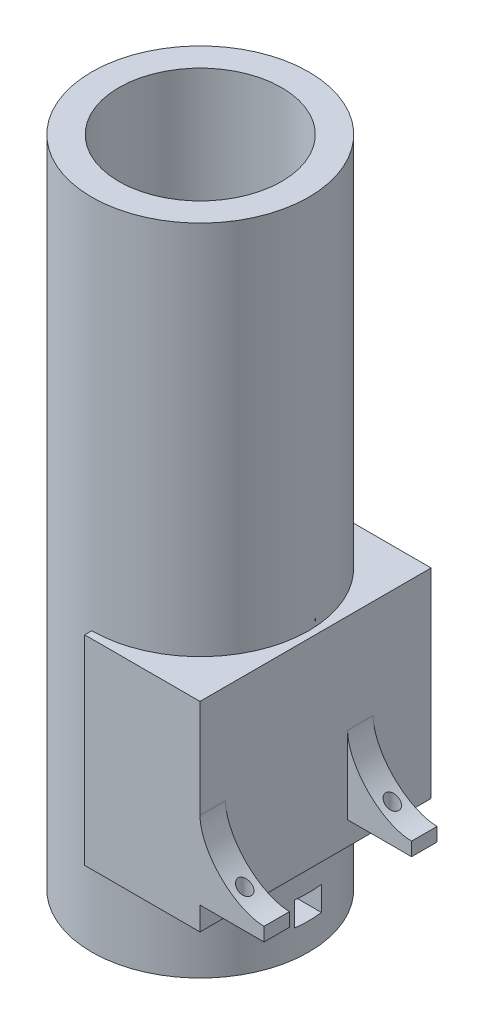
from build123d import *

# Parameters (mm, degrees)
SKETCH1_R                = 20
BOSS_EXTRUDE1_DEPTH      = 120.5
BOSS_EXTRUDE2_START      = 14.5
BOSS_EXTRUDE2_DEPTH      = 36.8
SKETCH7_W                = 4.7
SKETCH7_H                = 2.5
BOSS_EXTRUDE3_DEPTH      = 11.8
SKETCH2_R                = 15
CUT_EXTRUDE2_DEPTH       = 115.5
CUT_EXTRUDE3_REACH       = 135.373
CUT_EXTRUDE3_END_RADIUS  = 15
SKETCH12_W               = 30
SKETCH12_H               = 5.5
CUT_EXTRUDE5_DEPTH       = 5
FILLET3_SIZE             = 2.5
M2_CLEARANCE_HOLE3_D     = 2.4
M2_CLEARANCE_HOLE3_DEPTH = 2.5
M2_CLEARANCE_HOLE3_TIP   = 0.721032743
FILLET4_SIZE             = 11.8
CUT_EXTRUDE6_REACH       = 130.74
CUT_EXTRUDE6_END_RADIUS  = 15


with BuildPart() as part:
    # Sketch1 → Boss-Extrude1 (new body)
    with BuildSketch(Plane(origin=(0, 0, 0), x_dir=(1, 0, 0), z_dir=(0, 1, 0))):
        with Locations(Location((0, 0, 0), (0, 0, 270))):
            Circle(SKETCH1_R)
    extrude(amount=BOSS_EXTRUDE1_DEPTH)

    # Sketch6 → Boss-Extrude2 (add)
    with BuildSketch(Plane(origin=(0, 0, 0), x_dir=(1, 0, 0), z_dir=(0, 1, 0)).offset(BOSS_EXTRUDE2_START)):
        Polygon((21.25, 21.3), (21.25, 0), (21.25, -21.3), (0, -21.3), (0, 0), (0, 21.3), align=None)
    extrude(amount=BOSS_EXTRUDE2_DEPTH)

    # Sketch7 → Boss-Extrude3 (add)
    with BuildSketch(Plane(origin=(21.25, 0, 0), x_dir=(0, 0, -1), z_dir=(1, 0, 0))):
        with Locations((8.25, 20.05)):
            Rectangle(SKETCH7_W, SKETCH7_H)
        with Locations((-18.95, 20.05)):
            Rectangle(SKETCH7_W, SKETCH7_H)
    extrude(amount=BOSS_EXTRUDE3_DEPTH)

    # Sketch2 → Cut-Extrude2 (cut)
    with BuildSketch(Plane(origin=(0, 120.5, 0), x_dir=(1, 0, 0), z_dir=(0, 1, 0))):
        with Locations(Location((0, 0, 0), (0, 0, 270))):
            Circle(SKETCH2_R)
    extrude(amount=-CUT_EXTRUDE2_DEPTH, mode=Mode.SUBTRACT)

    # Cut-Extrude3: up to this cylinder (the profile starts outside it)
    cut_extrude3_end = Plane(origin=(0, 7.75, 0), z_dir=(0, 1, 0)) * Cylinder(CUT_EXTRUDE3_END_RADIUS, 301.746, mode=Mode.PRIVATE)
    # Sketch12 → Cut-Extrude3 (cut, up to the surface)
    with BuildSketch(Plane.ZY.offset(20), mode=Mode.PRIVATE) as cut_extrude3_sk1:
        with Locations((0, 7.75)):
            Rectangle(SKETCH12_W, SKETCH12_H)
    cut_extrude3_tool1 = extrude(cut_extrude3_sk1.sketch, amount=-CUT_EXTRUDE3_REACH, mode=Mode.PRIVATE) - cut_extrude3_end
    add(cut_extrude3_tool1.solids().sort_by_distance((-20, 7.75, 0))[0], mode=Mode.SUBTRACT)

    # Sketch13 → Cut-Extrude5 (cut)
    with BuildSketch(Plane.XZ):
        with BuildLine():
            Line((-13.228756555, 15), (-13.228756555, -15))
            ThreePointArc((-13.228756555, -15), (-20, 0), (-13.228756555, 15))
        make_face()
    extrude(amount=-CUT_EXTRUDE5_DEPTH, mode=Mode.SUBTRACT)

    # Fillet3
    # a fillet whose section is not a circle: 2.5 mm, written as the material it takes off along each edge
    with BuildSketch(Plane(origin=(-13.228756555, 5, 15), x_dir=(0, -1, 0), z_dir=(0, 0, -1))) as fillet3_piece_1:
        with BuildLine():
            Bezier((FILLET3_SIZE, 0), (0, 0), (0, -FILLET3_SIZE), weights=[1, 1.222222222, 1])
            Line((0, -FILLET3_SIZE), (0, 0))
            Line((0, 0), (FILLET3_SIZE, 0))
        make_face()
    extrude(amount=30, mode=Mode.SUBTRACT)

    # M2 Clearance Hole3
    with Locations(Plane(origin=(0, 18.8, 0), x_dir=(-1, 0, 0), z_dir=(0, -1, 0))):
        with Locations((-27.15, 8.25), (-27.15, -18.95)):
            Hole(M2_CLEARANCE_HOLE3_D / 2, depth=M2_CLEARANCE_HOLE3_DEPTH)
            with Locations((0, 0, -(M2_CLEARANCE_HOLE3_DEPTH + M2_CLEARANCE_HOLE3_TIP / 2))):  # 118° drill point
                Cone(0, M2_CLEARANCE_HOLE3_D / 2, M2_CLEARANCE_HOLE3_TIP, mode=Mode.SUBTRACT)

    # Fillet4
    # a fillet whose section is not a circle: 11.8 mm, written as the material it adds along each edge
    with BuildSketch(Plane(origin=(21.25, 21.3, 21.3), x_dir=(1, 0, 0), z_dir=(0, 0, -1))) as fillet4_piece_1_section:
        with BuildLine():
            Bezier((FILLET4_SIZE, 0), (0, 0), (0, -FILLET4_SIZE), weights=[1, 0.538461538, 1])
            Line((0, -FILLET4_SIZE), (0, 0))
            Line((0, 0), (FILLET4_SIZE, 0))
        make_face()
    fillet4_piece_1 = extrude(amount=4.7, mode=Mode.PRIVATE)
    fillet4_piece_1 = fillet4_piece_1 - Plane(origin=(27.15, 21.3, 18.95), x_dir=(1, 0, 0), z_dir=(0, 1, 0)) * Cylinder(1.2, 57, mode=Mode.PRIVATE)
    add(fillet4_piece_1)
    with BuildSketch(Plane(origin=(21.25, 21.3, 21.3), x_dir=(1, 0, 0), z_dir=(0, 0, -1))) as fillet4_piece_2_section:
        with BuildLine():
            Bezier((FILLET4_SIZE, 0), (0, 0), (0, -FILLET4_SIZE), weights=[1, 0.538461538, 1])
            Line((0, -FILLET4_SIZE), (0, 0))
            Line((0, 0), (FILLET4_SIZE, 0))
        make_face()
    fillet4_piece_2 = extrude(amount=34.2, mode=Mode.PRIVATE)
    fillet4_piece_2 = split(fillet4_piece_2, bisect_by=Plane(origin=(21.25, 21.3, -5.9), z_dir=(0, 0, -1)), keep=Keep.TOP, mode=Mode.PRIVATE)
    fillet4_piece_2 = split(fillet4_piece_2, bisect_by=Plane(origin=(21.25, 21.3, -10.6), z_dir=(0, 0, 1)), keep=Keep.TOP, mode=Mode.PRIVATE)
    fillet4_piece_2 = fillet4_piece_2 - Plane(origin=(27.15, 21.3, -8.25), x_dir=(1, 0, 0), z_dir=(0, 1, 0)) * Cylinder(1.2, 116, mode=Mode.PRIVATE)
    add(fillet4_piece_2)
    with BuildSketch(Plane(origin=(21.25, 21.3, -10.6), x_dir=(0, 1, 0), z_dir=(0, 0, 1))) as fillet4_piece_3_section:
        with BuildLine():
            Bezier((FILLET4_SIZE, 0), (0, 0), (0, -FILLET4_SIZE), weights=[1, 0.538461538, 1])
            Line((0, -FILLET4_SIZE), (0, 0))
            Line((0, 0), (FILLET4_SIZE, 0))
        make_face()
    fillet4_piece_3 = extrude(amount=4.7, mode=Mode.PRIVATE)
    fillet4_piece_3 = fillet4_piece_3 - Plane(origin=(27.15, 21.3, -8.25), x_dir=(1, 0, 0), z_dir=(0, 1, 0)) * Cylinder(1.2, 57, mode=Mode.PRIVATE)
    add(fillet4_piece_3)
    with BuildSketch(Plane(origin=(21.25, 21.3, -10.6), x_dir=(0, 1, 0), z_dir=(0, 0, 1))) as fillet4_piece_4_section:
        with BuildLine():
            Bezier((FILLET4_SIZE, 0), (0, 0), (0, -FILLET4_SIZE), weights=[1, 0.538461538, 1])
            Line((0, -FILLET4_SIZE), (0, 0))
            Line((0, 0), (FILLET4_SIZE, 0))
        make_face()
    fillet4_piece_4 = extrude(amount=34.2, mode=Mode.PRIVATE)
    fillet4_piece_4 = split(fillet4_piece_4, bisect_by=Plane(origin=(21.25, 21.3, 21.3), z_dir=(0, 0, -1)), keep=Keep.TOP, mode=Mode.PRIVATE)
    fillet4_piece_4 = split(fillet4_piece_4, bisect_by=Plane(origin=(21.25, 21.3, 16.6), z_dir=(0, 0, 1)), keep=Keep.TOP, mode=Mode.PRIVATE)
    fillet4_piece_4 = fillet4_piece_4 - Plane(origin=(27.15, 21.3, 18.95), x_dir=(1, 0, 0), z_dir=(0, 1, 0)) * Cylinder(1.2, 116, mode=Mode.PRIVATE)
    add(fillet4_piece_4)

    # Cut-Extrude6: up to this cylinder (the profile starts outside it)
    cut_extrude6_end = Plane(origin=(0, 7.25, 0), z_dir=(0, 1, 0)) * Cylinder(CUT_EXTRUDE6_END_RADIUS, 292.48, mode=Mode.PRIVATE)
    # Sketch21 → Cut-Extrude6 (cut, up to the surface)
    with BuildSketch(Plane(origin=(20, 0, 0), x_dir=(0, 0, -1), z_dir=(1, 0, 0)), mode=Mode.PRIVATE) as cut_extrude6_sk1:
        Polygon((0, 5), (-2.5, 5), (-2.5, 9.5), (2.5, 9.5), (2.5, 5), align=None)
    cut_extrude6_tool1 = extrude(cut_extrude6_sk1.sketch, amount=-CUT_EXTRUDE6_REACH, mode=Mode.PRIVATE) - cut_extrude6_end
    add(cut_extrude6_tool1.solids().sort_by_distance((20, 7.25, 0))[0], mode=Mode.SUBTRACT)


solid = part.part
